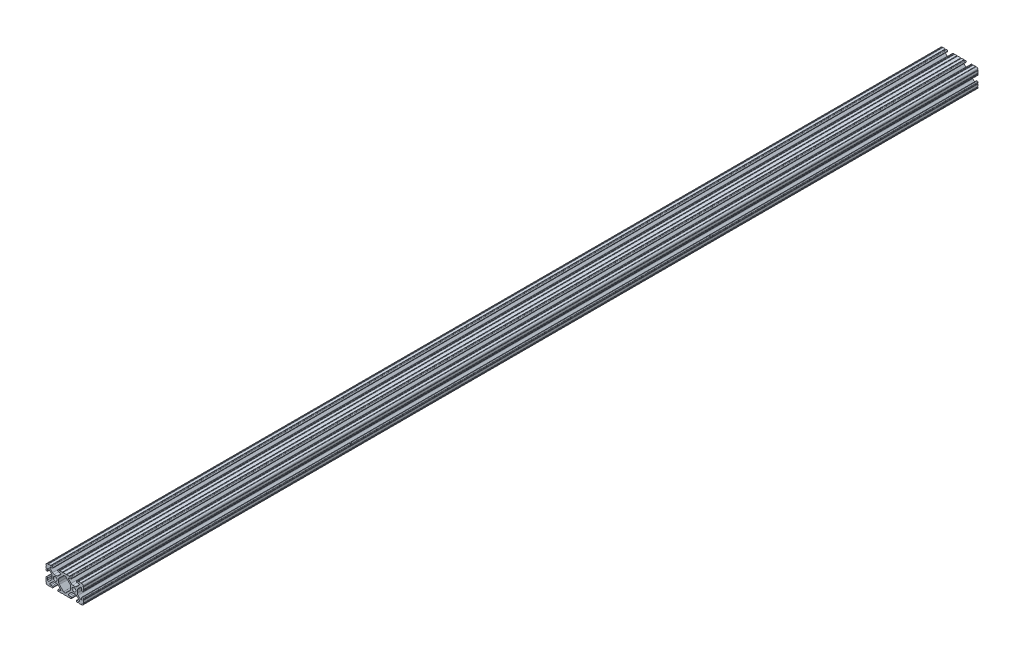
from build123d import *

# Parameters (mm, degrees)
SKETCH1_R               = 2.6035
BOSS_EXTRUDE1_DEPTH     = 609.6
CUT_EXTRUDE1_DEPTH      = 612.219219619
CUT_EXTRUDE1_DEPTH_BACK = 612.219219619
SKETCH2_R               = 3.5


with BuildPart() as part:
    # Sketch1 → Boss-Extrude1 (new, symmetric)
    with BuildSketch(Plane.XY):
        with BuildLine():
            Line((18.01710265, 12.7), (16.98745015, 12.7))
            ThreePointArc((16.98745015, 12.7), (16.245730386, 12.392769614), (15.9385, 11.65104985))
            Line((15.9385, 11.65104985), (15.9385, 11.53922))
            ThreePointArc((15.9385, 11.53922), (16.245750844, 10.797450844), (16.98752, 10.4902))
            Line((16.98752, 10.4902), (19.116384363, 10.4902))
            ThreePointArc((19.116384363, 10.4902), (20.052502933, 9.869096983), (19.844087081, 8.765172272))
            Line((19.844087081, 8.765172272), (16.618993479, 5.455112286))
            ThreePointArc((16.618993479, 5.455112286), (15.578994274, 4.745442459), (14.344932584, 4.4958))
            Line((14.344932584, 4.4958), (11.083317835, 4.4958))
            ThreePointArc((11.083317835, 4.4958), (9.854330953, 4.743306833), (8.816955189, 5.447238587))
            Line((8.816955189, 5.447238587), (5.564154119, 8.762652677))
            ThreePointArc((5.564154119, 8.762652677), (5.352591412, 9.867473037), (6.289393385, 10.4902))
            Line((6.289393385, 10.4902), (8.41248, 10.4902))
            ThreePointArc((8.41248, 10.4902), (9.154249156, 10.797450844), (9.4615, 11.53922))
            Line((9.4615, 11.53922), (9.4615, 11.65104985))
            ThreePointArc((9.4615, 11.65104985), (9.154269614, 12.392769614), (8.41254985, 12.7))
            Line((8.41254985, 12.7), (7.38288465, 12.7))
            ThreePointArc((7.38288465, 12.7), (6.87488465, 12.192), (6.36688465, 12.7))
            Line((6.36688465, 12.7), (3.14958095, 12.7))
            ThreePointArc((3.14958095, 12.7), (2.64158095, 12.192), (2.13358095, 12.7))
            Line((2.13358095, 12.7), (-2.13358095, 12.7))
            ThreePointArc((-2.13358095, 12.7), (-2.64158095, 12.192), (-3.14958095, 12.7))
            Line((-3.14958095, 12.7), (-6.36689735, 12.7))
            ThreePointArc((-6.36689735, 12.7), (-6.87489735, 12.192), (-7.38289735, 12.7))
            Line((-7.38289735, 12.7), (-8.41254985, 12.7))
            ThreePointArc((-8.41254985, 12.7), (-9.154269614, 12.392769614), (-9.4615, 11.65104985))
            Line((-9.4615, 11.65104985), (-9.4615, 11.53922))
            ThreePointArc((-9.4615, 11.53922), (-9.154249156, 10.797450844), (-8.41248, 10.4902))
            Line((-8.41248, 10.4902), (-6.283641037, 10.4902))
            ThreePointArc((-6.283641037, 10.4902), (-5.297291557, 9.829633109), (-5.532576693, 8.666071843))
            Line((-5.532576693, 8.666071843), (-8.809985098, 5.416263103))
            ThreePointArc((-8.809985098, 5.416263103), (-9.836720513, 4.734920264), (-11.045536121, 4.4958))
            Line((-11.045536121, 4.4958), (-14.354463879, 4.4958))
            ThreePointArc((-14.354463879, 4.4958), (-15.563279487, 4.734920264), (-16.590014902, 5.416263103))
            Line((-16.590014902, 5.416263103), (-19.867423307, 8.666071843))
            ThreePointArc((-19.867423307, 8.666071843), (-20.102708443, 9.829633109), (-19.116358963, 10.4902))
            Line((-19.116358963, 10.4902), (-16.98752, 10.4902))
            ThreePointArc((-16.98752, 10.4902), (-16.245750844, 10.797450844), (-15.9385, 11.53922))
            Line((-15.9385, 11.53922), (-15.9385, 11.65104985))
            ThreePointArc((-15.9385, 11.65104985), (-16.245730386, 12.392769614), (-16.98745015, 12.7))
            Line((-16.98745015, 12.7), (-18.01711535, 12.7))
            ThreePointArc((-18.01711535, 12.7), (-18.52511535, 12.192), (-19.03311535, 12.7))
            Line((-19.03311535, 12.7), (-22.2504, 12.7))
            ThreePointArc((-22.2504, 12.7), (-22.758323491, 12.192000006), (-23.266399977, 12.699846982))
            ThreePointArc((-23.266399977, 12.699846982), (-24.782522516, 12.082522516), (-25.399846982, 10.566399977))
            ThreePointArc((-25.399846982, 10.566399977), (-24.892000006, 10.058323491), (-25.4, 9.5504))
            Line((-25.4, 9.5504), (-25.4, 6.3330836))
            ThreePointArc((-25.4, 6.3330836), (-24.892, 5.8250836), (-25.4, 5.3170836))
            Line((-25.4, 5.3170836), (-25.4, 4.237520184))
            ThreePointArc((-25.4, 4.237520184), (-25.107393763, 3.531106237), (-24.400979816, 3.2385))
            Line((-24.400979816, 3.2385), (-24.23922, 3.2385))
            ThreePointArc((-24.23922, 3.2385), (-23.497450844, 3.545750844), (-23.1902, 4.28752))
            Line((-23.1902, 4.28752), (-23.1902, 6.334741132))
            ThreePointArc((-23.1902, 6.334741132), (-22.556026952, 7.286023527), (-21.434002553, 7.066535717))
            Line((-21.434002553, 7.066535717), (-18.147950853, 3.808156468))
            ThreePointArc((-18.147950853, 3.808156468), (-17.452759693, 2.774838327), (-17.208501877, 1.553619571))
            Line((-17.208501877, 1.553619571), (-17.208501877, -1.695179196))
            ThreePointArc((-17.208501877, -1.695179196), (-17.450738657, -2.911536421), (-18.140486065, -3.942289578))
            Line((-18.140486065, -3.942289578), (-21.431579576, -7.227386226))
            ThreePointArc((-21.431579576, -7.227386226), (-22.55444896, -7.449940594), (-23.1902, -6.498002195))
            Line((-23.1902, -6.498002195), (-23.1902, -4.28752))
            ThreePointArc((-23.1902, -4.28752), (-23.497450844, -3.545750844), (-24.23922, -3.2385))
            Line((-24.23922, -3.2385), (-24.35098, -3.2385))
            ThreePointArc((-24.35098, -3.2385), (-25.092749156, -3.545750844), (-25.4, -4.28752))
            Line((-25.4, -4.28752), (-25.4, -5.3171344))
            ThreePointArc((-25.4, -5.3171344), (-24.892, -5.8251344), (-25.4, -6.3331344))
            Line((-25.4, -6.3331344), (-25.4, -9.5504))
            ThreePointArc((-25.4, -9.5504), (-24.892000006, -10.058323491), (-25.399846982, -10.566399977))
            ThreePointArc((-25.399846982, -10.566399977), (-24.782522516, -12.082522516), (-23.266399977, -12.699846982))
            ThreePointArc((-23.266399977, -12.699846982), (-22.758323491, -12.192000006), (-22.2504, -12.7))
            Line((-22.2504, -12.7), (-19.03308995, -12.7))
            ThreePointArc((-19.03308995, -12.7), (-18.52508995, -12.192), (-18.01708995, -12.7))
            Line((-18.01708995, -12.7), (-16.9874692, -12.7))
            ThreePointArc((-16.9874692, -12.7), (-16.245700044, -12.392749156), (-15.9384492, -11.65098))
            Line((-15.9384492, -11.65098), (-15.9384492, -11.53922))
            ThreePointArc((-15.9384492, -11.53922), (-16.245700044, -10.797450844), (-16.9874692, -10.4902))
            Line((-16.9874692, -10.4902), (-19.116358963, -10.4902))
            ThreePointArc((-19.116358963, -10.4902), (-20.055197748, -9.862578342), (-19.834124023, -8.755124678))
            Line((-19.834124023, -8.755124678), (-16.49660751, -5.423689618))
            ThreePointArc((-16.49660751, -5.423689618), (-15.467274017, -4.736928798), (-14.253591699, -4.4958))
            Line((-14.253591699, -4.4958), (-11.146408301, -4.4958))
            ThreePointArc((-11.146408301, -4.4958), (-9.932725983, -4.736928798), (-8.90339249, -5.423689618))
            Line((-8.90339249, -5.423689618), (-5.565875977, -8.755124678))
            ThreePointArc((-5.565875977, -8.755124678), (-5.344802252, -9.862578342), (-6.283641037, -10.4902))
            Line((-6.283641037, -10.4902), (-8.4125308, -10.4902))
            ThreePointArc((-8.4125308, -10.4902), (-9.154299956, -10.797450844), (-9.4615508, -11.53922))
            Line((-9.4615508, -11.53922), (-9.4615508, -11.65098))
            ThreePointArc((-9.4615508, -11.65098), (-9.154299956, -12.392749156), (-8.4125308, -12.7))
            Line((-8.4125308, -12.7), (-7.38287195, -12.7))
            ThreePointArc((-7.38287195, -12.7), (-6.87487195, -12.192), (-6.36687195, -12.7))
            Line((-6.36687195, -12.7), (-3.14960635, -12.7))
            ThreePointArc((-3.14960635, -12.7), (-2.64160635, -12.192), (-2.13360635, -12.7))
            Line((-2.13360635, -12.7), (2.13360635, -12.7))
            ThreePointArc((2.13360635, -12.7), (2.64159365, -12.1920127), (3.14958095, -12.7))
            Line((3.14958095, -12.7), (6.36691005, -12.7))
            ThreePointArc((6.36691005, -12.7), (6.87491005, -12.192), (7.38291005, -12.7))
            Line((7.38291005, -12.7), (8.4125308, -12.7))
            ThreePointArc((8.4125308, -12.7), (9.154299956, -12.392749156), (9.4615508, -11.65098))
            Line((9.4615508, -11.65098), (9.4615508, -11.53922))
            ThreePointArc((9.4615508, -11.53922), (9.154299956, -10.797450844), (8.4125308, -10.4902))
            Line((8.4125308, -10.4902), (6.289393385, -10.4902))
            ThreePointArc((6.289393385, -10.4902), (5.231590322, -9.783049717), (5.480677245, -8.535265862))
            Line((5.480677245, -8.535265862), (8.597933595, -5.423689618))
            ThreePointArc((8.597933595, -5.423689618), (9.627267088, -4.736928798), (10.840949406, -4.4958))
            Line((10.840949406, -4.4958), (14.102564155, -4.4958))
            ThreePointArc((14.102564155, -4.4958), (15.215927525, -4.697410182), (16.187895372, -5.276636531))
            Line((16.187895372, -5.276636531), (19.868247549, -8.482246082))
            ThreePointArc((19.868247549, -8.482246082), (20.188435806, -9.746879864), (19.116384363, -10.4902))
            Line((19.116384363, -10.4902), (16.9874692, -10.4902))
            ThreePointArc((16.9874692, -10.4902), (16.245700044, -10.797450844), (15.9384492, -11.53922))
            Line((15.9384492, -11.53922), (15.9384492, -11.65098))
            ThreePointArc((15.9384492, -11.65098), (16.245700044, -12.392749156), (16.9874692, -12.7))
            Line((16.9874692, -12.7), (18.01710265, -12.7))
            ThreePointArc((18.01710265, -12.7), (18.52510265, -12.192), (19.03310265, -12.7))
            Line((19.03310265, -12.7), (22.2504, -12.7))
            ThreePointArc((22.2504, -12.7), (22.758323491, -12.192000006), (23.266399977, -12.699846982))
            ThreePointArc((23.266399977, -12.699846982), (24.782522516, -12.082522516), (25.399846982, -10.566399977))
            ThreePointArc((25.399846982, -10.566399977), (24.892000006, -10.058323492), (25.4, -9.550400001))
            Line((25.4, -9.550400001), (25.4, -6.333083592))
            ThreePointArc((25.4, -6.333083592), (24.892000001, -5.825083593), (25.4, -5.317083593))
            Line((25.4, -5.317083593), (25.4, -4.237520184))
            ThreePointArc((25.4, -4.237520184), (25.107393763, -3.531106237), (24.400979816, -3.2385))
            Line((24.400979816, -3.2385), (24.189220184, -3.2385))
            ThreePointArc((24.189220184, -3.2385), (23.482806237, -3.531106237), (23.1902, -4.237520184))
            Line((23.1902, -4.237520184), (23.1902, -6.155876159))
            ThreePointArc((23.1902, -6.155876159), (22.62232736, -7.038258539), (21.583974541, -6.886926384))
            Line((21.583974541, -6.886926384), (18.29817066, -4.024970844))
            ThreePointArc((18.29817066, -4.024970844), (17.493730985, -2.946044689), (17.208501877, -1.630807374))
            Line((17.208501877, -1.630807374), (17.208501877, 1.630807374))
            ThreePointArc((17.208501877, 1.630807374), (17.442348332, 2.82673414), (18.109440981, 3.846495088))
            Line((18.109440981, 3.846495088), (21.526346532, 7.353420386))
            ThreePointArc((21.526346532, 7.353420386), (22.585896263, 7.574939077), (23.1902, 6.676867167))
            Line((23.1902, 6.676867167), (23.1902, 4.237520184))
            ThreePointArc((23.1902, 4.237520184), (23.482806237, 3.531106237), (24.189220184, 3.2385))
            Line((24.189220184, 3.2385), (24.400979816, 3.2385))
            ThreePointArc((24.400979816, 3.2385), (25.107393763, 3.531106237), (25.4, 4.237520184))
            Line((25.4, 4.237520184), (25.4, 5.3170836))
            ThreePointArc((25.4, 5.3170836), (24.891949193, 5.825134407), (25.4, 6.333185215))
            Line((25.4, 6.333185215), (25.4, 9.550400015))
            ThreePointArc((25.4, 9.550400015), (24.892000013, 10.058323498), (25.399846982, 10.566399977))
            ThreePointArc((25.399846982, 10.566399977), (24.782522516, 12.082522516), (23.266399977, 12.699846982))
            ThreePointArc((23.266399977, 12.699846982), (22.758323491, 12.192000006), (22.2504, 12.7))
            Line((22.2504, 12.7), (19.03310265, 12.7))
            ThreePointArc((19.03310265, 12.7), (18.52510265, 12.192), (18.01710265, 12.7))
        make_face()
        with Locations((-12.7, 0)):
            Circle(SKETCH1_R, mode=Mode.SUBTRACT)
        with Locations((12.7, 0)):
            Circle(SKETCH1_R, mode=Mode.SUBTRACT)
        with BuildLine():
            Line((-7.259513935, -3.869413038), (-1.545748891, -9.572766749))
            ThreePointArc((-1.545748891, -9.572766749), (-1.035199478, -9.913400116), (-0.433213048, -10.033))
            Line((-0.433213048, -10.033), (0.433213048, -10.033))
            ThreePointArc((0.433213048, -10.033), (1.035199478, -9.913400116), (1.545748891, -9.572766749))
            Line((1.545748891, -9.572766749), (7.259513935, -3.869413038))
            ThreePointArc((7.259513935, -3.869413038), (7.949261343, -2.838659881), (8.191498123, -1.622302656))
            Line((8.191498123, -1.622302656), (8.191498123, 1.622302656))
            ThreePointArc((8.191498123, 1.622302656), (7.955573352, 2.823327967), (7.282860769, 3.845864069))
            Line((7.282860769, 3.845864069), (1.675572808, 9.561086461))
            ThreePointArc((1.675572808, 9.561086461), (1.161034429, 9.910236611), (0.551456936, 10.033))
            Line((0.551456936, 10.033), (-0.395199982, 10.033))
            ThreePointArc((-0.395199982, 10.033), (-0.994772524, 9.914396349), (-1.50403329, 9.576450301))
            Line((-1.50403329, 9.576450301), (-7.252049147, 3.876839553))
            ThreePointArc((-7.252049147, 3.876839553), (-7.947240307, 2.843521412), (-8.191498123, 1.622302656))
            Line((-8.191498123, 1.622302656), (-8.191498123, -1.622302656))
            ThreePointArc((-8.191498123, -1.622302656), (-7.949261343, -2.838659881), (-7.259513935, -3.869413038))
        make_face(mode=Mode.SUBTRACT)
    extrude(amount=BOSS_EXTRUDE1_DEPTH, both=True)

    # Sketch2 → Cut-Extrude1 (cut, two sides: drawn at the far end of the back side and taken through both)
    with BuildSketch(Plane(origin=(17.208501877, 0, 0), x_dir=(0, 0, -1), z_dir=(1, 0, 0)).offset(-CUT_EXTRUDE1_DEPTH_BACK)):
        with Locations((244.47, 0)):
            Circle(SKETCH2_R)
        with Locations((-244.47, 0)):
            Circle(SKETCH2_R)
    extrude(amount=CUT_EXTRUDE1_DEPTH + CUT_EXTRUDE1_DEPTH_BACK, mode=Mode.SUBTRACT)


solid = part.part
